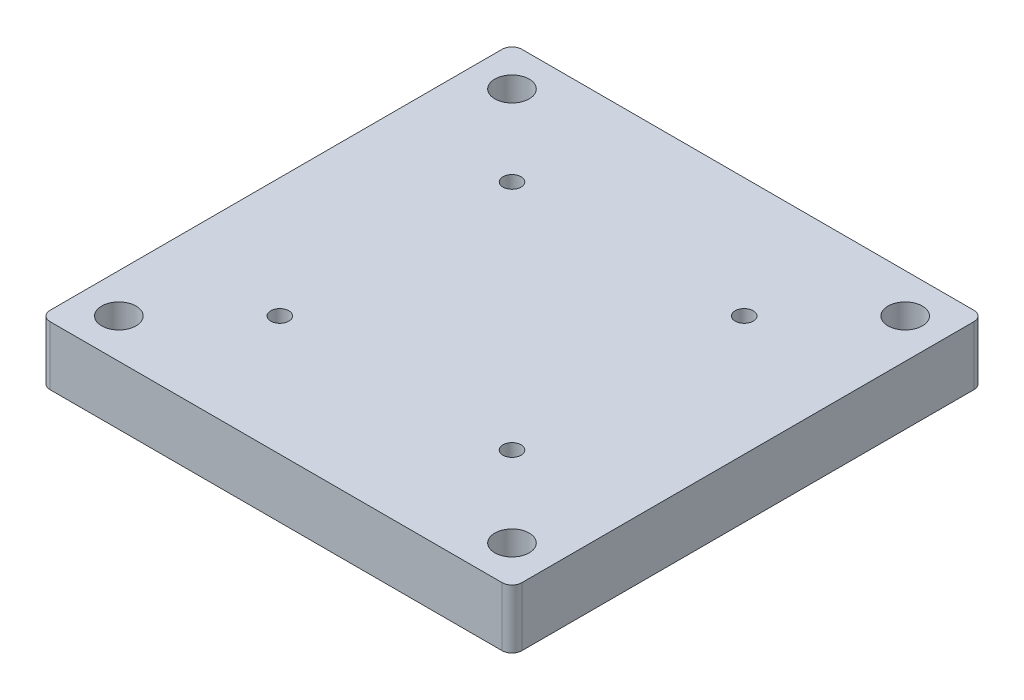
from build123d import *

# Parameters (mm, degrees)
SKETCH1_W                                        = 152.4
SKETCH1_H                                        = 152.4
BOSS_EXTRUDE1_DEPTH                              = 19.05
CBORE_FOR_1_4_SOCKET_HEAD_CAP_SCREW1_D           = 6.5278
CBORE_FOR_1_4_SOCKET_HEAD_CAP_SCREW1_CBORE_D     = 11.1125
CBORE_FOR_1_4_SOCKET_HEAD_CAP_SCREW1_CBORE_DEPTH = 8.89
FILLET1_R                                        = 3.175
CBORE_FOR_10_BUTTON_HEAD_CAP_SCREW1_D            = 5.842
CBORE_FOR_10_BUTTON_HEAD_CAP_SCREW1_CBORE_D      = 10.541
CBORE_FOR_10_BUTTON_HEAD_CAP_SCREW1_CBORE_DEPTH  = 7.874


with BuildPart() as part:
    # Sketch1 → Boss-Extrude1 (new body)
    with BuildSketch(Plane(origin=(0, 0, 0), x_dir=(1, 0, 0), z_dir=(0, 1, 0))):
        Rectangle(SKETCH1_W, SKETCH1_H)
    extrude(amount=BOSS_EXTRUDE1_DEPTH)

    # CBORE for 1/4 Socket Head Cap Screw1 (through all)
    with Locations(Plane(origin=(0, 19.05, 0), x_dir=(1, 0, 0), z_dir=(0, 1, 0))):
        with Locations((-63.5, 63.5), (63.5, 63.5), (63.5, -63.5), (-63.5, -63.5)):
            CounterBoreHole(CBORE_FOR_1_4_SOCKET_HEAD_CAP_SCREW1_D / 2, CBORE_FOR_1_4_SOCKET_HEAD_CAP_SCREW1_CBORE_D / 2, CBORE_FOR_1_4_SOCKET_HEAD_CAP_SCREW1_CBORE_DEPTH)

    # Fillet1
    fillet1_edges = [part.edges().sort_by_distance(p)[0] for p in [
        (-76.2, 9.525, 76.2),
        (76.2, 9.525, 76.2),
        (76.2, 9.525, -76.2),
        (-76.2, 9.525, -76.2),
    ]]
    fillet(fillet1_edges, radius=FILLET1_R)

    # CBORE for #10 Button Head Cap Screw1 (through all)
    with Locations(Plane(origin=(0, 0, 0), x_dir=(-1, 0, 0), z_dir=(0, -1, 0))):
        with Locations((37.5, -37.5), (-37.5, -37.5), (37.5, 37.5), (-37.5, 37.5)):
            CounterBoreHole(CBORE_FOR_10_BUTTON_HEAD_CAP_SCREW1_D / 2, CBORE_FOR_10_BUTTON_HEAD_CAP_SCREW1_CBORE_D / 2, CBORE_FOR_10_BUTTON_HEAD_CAP_SCREW1_CBORE_DEPTH)


solid = part.part
